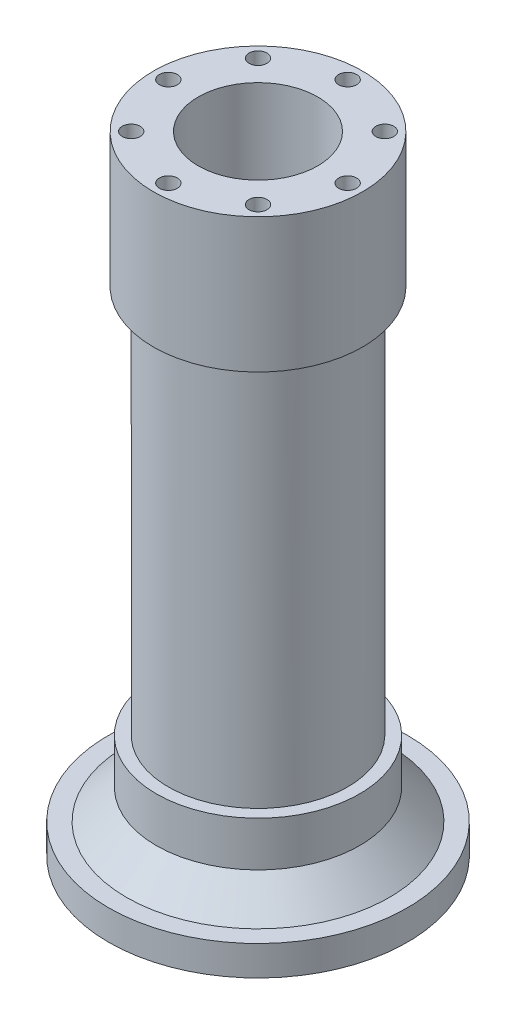
from build123d import *

# Parameters (mm, degrees)
SKETCH1_R                = 30
SKETCH1_R_2              = 25
BOSS_EXTRUDE1_DEPTH      = 200
SKETCH3_R                = 50
SKETCH3_R_2              = 25
BOSS_EXTRUDE3_DEPTH      = 10
BOSS_EXTRUDE4_DEPTH      = 10
BOSS_EXTRUDE4_DEPTH_BACK = 35
SKETCH4_R                = 35
SKETCH4_R_2              = 25
SKETCH5_R                = 3
CUT_EXTRUDE1_DEPTH       = 6
SKETCH7_R                = 34
SKETCH7_R_2              = 25
BOSS_EXTRUDE5_DEPTH      = 25
SKETCH9_R                = 25
SKETCH9_R_2              = 20
BOSS_EXTRUDE7_DEPTH      = 210
SKETCH10_R               = 3
CUT_EXTRUDE2_DEPTH       = 5
SKETCH11_R               = 2
CUT_EXTRUDE3_DEPTH       = 52
SKETCH12_R               = 30
SKETCH12_R_2             = 20
CUT_EXTRUDE6_DEPTH       = 6
CHAMFER5_SIZE            = 6
SKETCH14_R               = 3.5
CUT_EXTRUDE7_DEPTH       = 3
CHAMFER6_SIZE            = 10


# Read off the part's stored shape, not the designer's step: Intersect1, Intersect2, Intersect3
with BuildPart() as part:
    # Sketch1 → Boss-Extrude1 (new body)
    with BuildSketch(Plane(origin=(0, 0, 0), x_dir=(1, 0, 0), z_dir=(0, 1, 0))):
        with Locations(Location((0, 0, 0), (0, 0, 270))):
            Circle(SKETCH1_R)
        with Locations(Location((0, 0, 0), (0, 0, 270))):
            Circle(SKETCH1_R_2, mode=Mode.SUBTRACT)
    extrude(amount=BOSS_EXTRUDE1_DEPTH)

    # Sketch3 → Boss-Extrude3 (add)
    with BuildSketch(Plane.XZ):
        with Locations(Location((0, 0, 0), (0, 0, 270))):
            Circle(SKETCH3_R)
        with Locations(Location((0, 0, 0), (0, 0, 90))):
            Circle(SKETCH3_R_2, mode=Mode.SUBTRACT)
    extrude(amount=-BOSS_EXTRUDE3_DEPTH)

    # Sketch4 → Boss-Extrude4 (add, two sides: drawn at the far end of the back side and taken through both)
    with BuildSketch(Plane(origin=(0, 200, 0), x_dir=(1, 0, 0), z_dir=(0, 1, 0)).offset(-BOSS_EXTRUDE4_DEPTH_BACK)):
        with Locations(Location((0, 0, 0), (0, 0, 270))):
            Circle(SKETCH4_R)
        with Locations(Location((0, 0, 0), (0, 0, 270))):
            Circle(SKETCH4_R_2, mode=Mode.SUBTRACT)
    extrude(amount=BOSS_EXTRUDE4_DEPTH + BOSS_EXTRUDE4_DEPTH_BACK)

    # Sketch5 → Cut-Extrude1 (cut)
    with BuildSketch(Plane(origin=(0, 210, 0), x_dir=(1, 0, 0), z_dir=(0, 1, 0))):
        with Locations(Location((-30, 0, 0), (0, 0, 270))):
            Circle(SKETCH5_R)
        with Locations(Location((-21.213203436, 21.213203436, 0), (0, 0, 270))):
            Circle(SKETCH5_R)
        with Locations(Location((0, 30, 0), (0, 0, 270))):
            Circle(SKETCH5_R)
        with Locations(Location((21.213203436, 21.213203436, 0), (0, 0, 270))):
            Circle(SKETCH5_R)
        with Locations(Location((30, 0, 0), (0, 0, 270))):
            Circle(SKETCH5_R)
        with Locations(Location((21.213203436, -21.213203436, 0), (0, 0, 270))):
            Circle(SKETCH5_R)
        with Locations(Location((0, -30, 0), (0, 0, 270))):
            Circle(SKETCH5_R)
        with Locations(Location((-21.213203436, -21.213203436, 0), (0, 0, 270))):
            Circle(SKETCH5_R)
    extrude(amount=-CUT_EXTRUDE1_DEPTH, mode=Mode.SUBTRACT)


with BuildPart() as body_2:
    # Intersect1: the piece on the far side of the plane
    add(part.part)
    split(bisect_by=Plane(origin=(0, 10, 0), x_dir=(1, 0, 0), z_dir=(0, 1, 0)), keep=Keep.BOTTOM)


with BuildPart() as part_1:
    add(part.part)

    # Intersect1
    split(bisect_by=Plane(origin=(0, 10, 0), x_dir=(1, 0, 0), z_dir=(0, 1, 0)), keep=Keep.TOP)

    # Sketch7 → Boss-Extrude5 (add)
    with BuildSketch(Plane.XZ.offset(-10)):
        with Locations(Location((0, 0, 0), (0, 0, 270))):
            Circle(SKETCH7_R)
        with Locations(Location((0, 0, 0), (0, 0, 90))):
            Circle(SKETCH7_R_2, mode=Mode.SUBTRACT)
    extrude(amount=-BOSS_EXTRUDE5_DEPTH)

    # Combine1: union body 2
    add(body_2.part)


with BuildPart() as body_2_2:
    # Intersect2: the piece on the far side of the plane
    add(part_1.part)
    split(bisect_by=Plane(origin=(0, 35, 0), x_dir=(1, 0, 0), z_dir=(0, 1, 0)), keep=Keep.BOTTOM)


with BuildPart() as part_2:
    add(part_1.part)

    # Intersect2
    split(bisect_by=Plane(origin=(0, 35, 0), x_dir=(1, 0, 0), z_dir=(0, 1, 0)), keep=Keep.TOP)


with BuildPart() as body_3:
    # Sketch9 → Boss-Extrude7 (new body)
    with BuildSketch(Plane.XZ):
        with Locations(Location((0, 0, 0), (0, 0, 90))):
            Circle(SKETCH9_R)
        with Locations(Location((0, 0, 0), (0, 0, 270))):
            Circle(SKETCH9_R_2, mode=Mode.SUBTRACT)
    extrude(amount=-BOSS_EXTRUDE7_DEPTH)


with BuildPart() as body_4:
    # Intersect3: the piece on the far side of the plane
    add(body_3.part)
    split(bisect_by=Plane(origin=(0, 35, 0), x_dir=(1, 0, 0), z_dir=(0, 1, 0)), keep=Keep.BOTTOM)

    # Combine2: union body 2 2
    add(body_2_2.part)

    # Sketch11 → Cut-Extrude3 (cut)
    with BuildSketch(Plane(origin=(0, 35, 0), x_dir=(1, 0, 0), z_dir=(0, 1, 0))):
        with Locations(Location((-25, 0, 0), (0, 0, 270))):
            Circle(SKETCH11_R)
        with Locations(Location((-17.67766953, 17.67766953, 0), (0, 0, 270))):
            Circle(SKETCH11_R)
        with Locations(Location((0, 25, 0), (0, 0, 270))):
            Circle(SKETCH11_R)
        with Locations(Location((17.67766953, 17.67766953, 0), (0, 0, 270))):
            Circle(SKETCH11_R)
        with Locations(Location((25, 0, 0), (0, 0, 270))):
            Circle(SKETCH11_R)
        with Locations(Location((17.67766953, -17.67766953, 0), (0, 0, 270))):
            Circle(SKETCH11_R)
        with Locations(Location((0, -25, 0), (0, 0, 270))):
            Circle(SKETCH11_R)
        with Locations(Location((-17.67766953, -17.67766953, 0), (0, 0, 270))):
            Circle(SKETCH11_R)
    extrude(amount=-CUT_EXTRUDE3_DEPTH, mode=Mode.SUBTRACT)

    # Sketch12 → Cut-Extrude6 (cut)
    with BuildSketch(Plane.XZ):
        with Locations(Location((0, 0, 0), (0, 0, 270))):
            Circle(SKETCH12_R)
        with Locations(Location((0, 0, 0), (0, 0, 90))):
            Circle(SKETCH12_R_2, mode=Mode.SUBTRACT)
    extrude(amount=-CUT_EXTRUDE6_DEPTH, mode=Mode.SUBTRACT)

    # Chamfer5
    chamfer5_edges = [body_4.edges().sort_by_distance(p)[0] for p in [
        (0, 0, 30),
    ]]
    chamfer(chamfer5_edges, length=CHAMFER5_SIZE - 0.0001)  # a hair under: the kernel refuses the full size

    # Sketch14 → Cut-Extrude7 (cut)
    with BuildSketch(Plane.XZ.offset(-6)):
        with Locations(Location((-25, 0, 0), (0, 0, 270))):
            Circle(SKETCH14_R)
        with Locations(Location((-17.67766953, 17.67766953, 0), (0, 0, 270))):
            Circle(SKETCH14_R)
        with Locations(Location((0, 25, 0), (0, 0, 270))):
            Circle(SKETCH14_R)
        with Locations(Location((17.67766953, 17.67766953, 0), (0, 0, 270))):
            Circle(SKETCH14_R)
        with Locations(Location((25, 0, 0), (0, 0, 270))):
            Circle(SKETCH14_R)
        with Locations(Location((17.67766953, -17.67766953, 0), (0, 0, 270))):
            Circle(SKETCH14_R)
        with Locations(Location((0, -25, 0), (0, 0, 270))):
            Circle(SKETCH14_R)
        with Locations(Location((-17.67766953, -17.67766953, 0), (0, 0, 270))):
            Circle(SKETCH14_R)
    extrude(amount=-CUT_EXTRUDE7_DEPTH, mode=Mode.SUBTRACT)

    # Chamfer6
    chamfer6_edges = [body_4.edges().sort_by_distance(p)[0] for p in [
        (0, 10, 34),
    ]]
    chamfer(chamfer6_edges, length=CHAMFER6_SIZE)


with BuildPart() as body_3_1:
    add(body_3.part)

    # Intersect3
    split(bisect_by=Plane(origin=(0, 35, 0), x_dir=(1, 0, 0), z_dir=(0, 1, 0)), keep=Keep.TOP)

    # Combine3: union part
    add(part_2.part)

    # Sketch10 → Cut-Extrude2 (cut)
    with BuildSketch(Plane.XZ.offset(-35)):
        with Locations(Location((-25, 0, 0), (0, 0, 270))):
            Circle(SKETCH10_R)
        with Locations(Location((-17.67766953, 17.67766953, 0), (0, 0, 270))):
            Circle(SKETCH10_R)
        with Locations(Location((0, 25, 0), (0, 0, 270))):
            Circle(SKETCH10_R)
        with Locations(Location((17.67766953, 17.67766953, 0), (0, 0, 270))):
            Circle(SKETCH10_R)
        with Locations(Location((25, 0, 0), (0, 0, 270))):
            Circle(SKETCH10_R)
        with Locations(Location((17.67766953, -17.67766953, 0), (0, 0, 270))):
            Circle(SKETCH10_R)
        with Locations(Location((0, -25, 0), (0, 0, 270))):
            Circle(SKETCH10_R)
        with Locations(Location((-17.67766953, -17.67766953, 0), (0, 0, 270))):
            Circle(SKETCH10_R)
    extrude(amount=-CUT_EXTRUDE2_DEPTH, mode=Mode.SUBTRACT)


solid = Compound([body_4.part, body_3_1.part])
